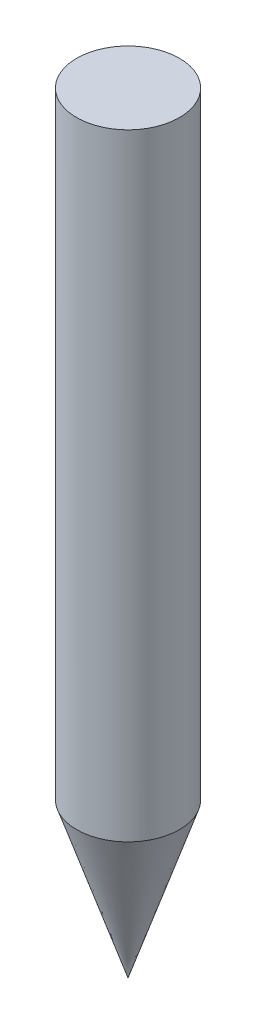
from build123d import *


with BuildPart() as part:
    # Sketch1 → Revolve1 (revolve)
    with BuildSketch(Plane.XY):
        Polygon((0, 0), (4, 12), (4, 60), (0, 60), align=None)
    revolve(axis=Axis((0, 0, 0), (0, 1, 0)))


solid = part.part
